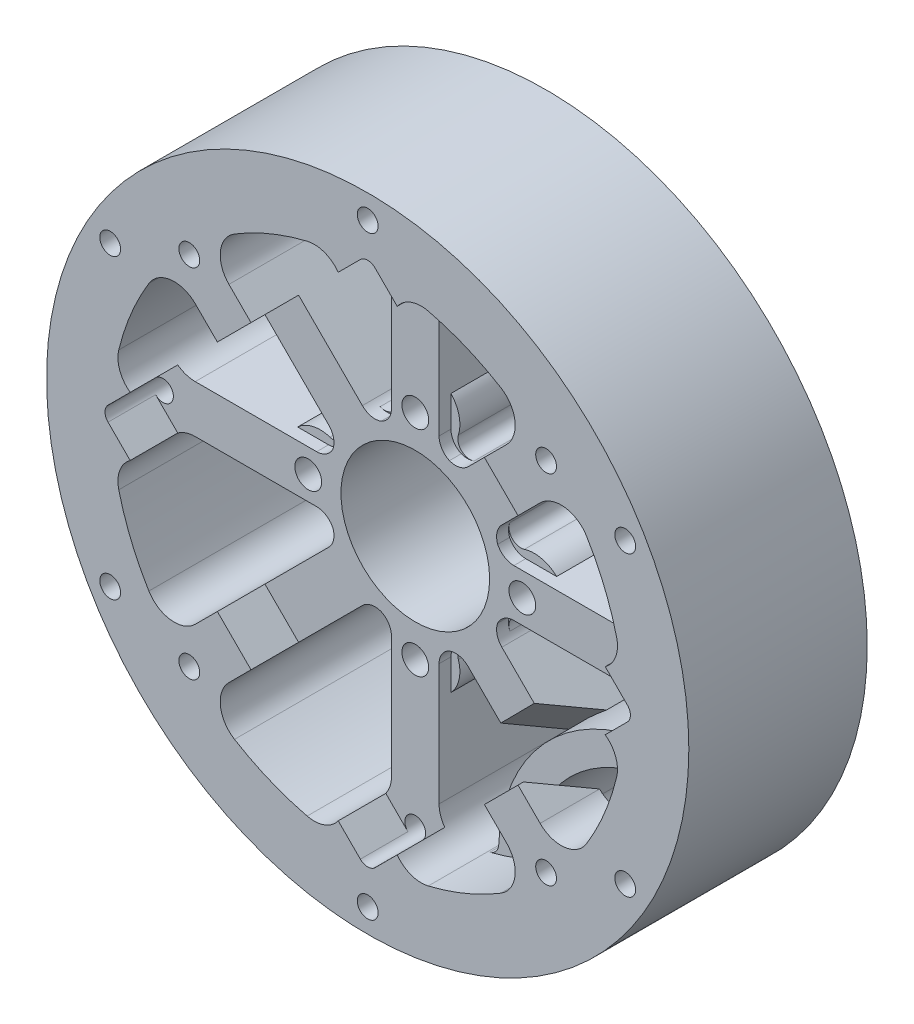
from build123d import *

# Parameters (mm, degrees)
SKETCH1_R                = 54
BOSS_EXTRUDE1_DEPTH      = 30
CUT_EXTRUDE4_DEPTH       = 68
SKETCH3_R                = 2.25
CUT_EXTRUDE5_DEPTH       = 64
SKETCH4_R                = 1.75
CUT_EXTRUDE6_DEPTH       = 50
FILLET1_R                = 5
FILLET3_R                = 3
SKETCH5_R                = 11
CUT_EXTRUDE7_DEPTH       = 20
SKETCH6_R                = 45.5
SKETCH6_R_2              = 43.5
BOSS_EXTRUDE2_DEPTH      = 20
CUT_EXTRUDE8_DEPTH       = 52
CIRPATTERN1_COUNT        = 8
CUT_EXTRUDE9_START       = -20
CUT_EXTRUDE9_DEPTH       = 20
CUT_EXTRUDE11_DEPTH      = 100.676435702
CUT_EXTRUDE11_DEPTH_BACK = 100.676435702
SKETCH13_W               = 15
SKETCH13_H               = 10
BOSS_EXTRUDE3_START      = -20
BOSS_EXTRUDE3_DEPTH      = 20
FILLET4_R                = 2
FILLET5_R                = 2
FILLET6_R                = 2
BOSS_EXTRUDE4_START      = -20
SKETCH16_R               = 5.5
SKETCH16_R_2             = 2.25
BOSS_EXTRUDE4_DEPTH      = 20
FILLET7_DEPTH            = 20
SKETCH17_R               = 12.5
CUT_EXTRUDE12_DEPTH      = 37
CUT_EXTRUDE14_DEPTH      = 8


with BuildPart() as part:
    # Sketch1 → Boss-Extrude1 (new body)
    with BuildSketch(Plane.XY):
        Circle(SKETCH1_R)
    extrude(amount=BOSS_EXTRUDE1_DEPTH)

    # Sketch2 → Cut-Extrude4 (cut)
    with BuildSketch(Plane.XY.offset(30)):
        with BuildLine():
            ThreePointArc((-7.394097025, 13.050951275), (-5.740251485, 13.858192988), (-4, 14.456832295))
            Line((-4, 14.456832295), (-4, 42.893897002))
            ThreePointArc((-4, 42.893897002), (-16.486002266, 39.800730261), (-27.502138317, 33.158992566))
            Line((-27.502138317, 33.158992566), (-7.394097025, 13.050951275))
        make_face()
        with BuildLine():
            Line((4, 42.893897002), (4, 14.456832295))
            ThreePointArc((4, 14.456832295), (5.740251485, 13.858192988), (7.394097025, 13.050951275))
            Line((7.394097025, 13.050951275), (27.502138317, 33.158992566))
            ThreePointArc((27.502138317, 33.158992566), (16.486002266, 39.800730261), (4, 42.893897002))
        make_face()
        with BuildLine():
            Line((33.158992566, 27.502138317), (13.050951275, 7.394097025))
            ThreePointArc((13.050951275, 7.394097025), (13.858192988, 5.740251485), (14.456832295, 4))
            Line((14.456832295, 4), (42.893897002, 4))
            ThreePointArc((42.893897002, 4), (39.800730261, 16.486002266), (33.158992566, 27.502138317))
        make_face()
        with BuildLine():
            Line((42.893897002, -4), (14.456832295, -4))
            ThreePointArc((14.456832295, -4), (13.858192988, -5.740251485), (13.050951275, -7.394097025))
            Line((13.050951275, -7.394097025), (33.158992566, -27.502138317))
            ThreePointArc((33.158992566, -27.502138317), (39.800730261, -16.486002266), (42.893897002, -4))
        make_face()
        with BuildLine():
            Line((27.502138317, -33.158992566), (7.394097025, -13.050951275))
            ThreePointArc((7.394097025, -13.050951275), (5.740251485, -13.858192988), (4, -14.456832295))
            Line((4, -14.456832295), (4, -42.893897002))
            ThreePointArc((4, -42.893897002), (16.486002266, -39.800730261), (27.502138317, -33.158992566))
        make_face()
        with BuildLine():
            ThreePointArc((-4, -14.456832295), (-5.740251485, -13.858192988), (-7.394097025, -13.050951275))
            Line((-7.394097025, -13.050951275), (-27.502138317, -33.158992566))
            ThreePointArc((-27.502138317, -33.158992566), (-16.486002266, -39.800730261), (-4, -42.893897002))
            Line((-4, -42.893897002), (-4, -14.456832295))
        make_face()
        with BuildLine():
            ThreePointArc((-13.050951275, -7.394097025), (-13.858192988, -5.740251485), (-14.456832295, -4))
            Line((-14.456832295, -4), (-42.893897002, -4))
            ThreePointArc((-42.893897002, -4), (-39.800730261, -16.486002266), (-33.158992566, -27.502138317))
            Line((-33.158992566, -27.502138317), (-13.050951275, -7.394097025))
        make_face()
        with BuildLine():
            ThreePointArc((-14.456832295, 4), (-13.858192988, 5.740251485), (-13.050951275, 7.394097025))
            Line((-13.050951275, 7.394097025), (-33.158992566, 27.502138317))
            ThreePointArc((-33.158992566, 27.502138317), (-39.800730261, 16.486002266), (-42.893897002, 4))
            Line((-42.893897002, 4), (-14.456832295, 4))
        make_face()
    extrude(amount=-CUT_EXTRUDE4_DEPTH, mode=Mode.SUBTRACT)

    # Sketch3 → Cut-Extrude5 (cut)
    with BuildSketch(Plane.XY.offset(30)):
        with Locations((0, 18)):
            Circle(SKETCH3_R)
        with Locations((18, 0)):
            Circle(SKETCH3_R)
        with Locations((0, -18)):
            Circle(SKETCH3_R)
        with Locations((-18, 0)):
            Circle(SKETCH3_R)
    extrude(amount=-CUT_EXTRUDE5_DEPTH, mode=Mode.SUBTRACT)

    # Sketch4 → Cut-Extrude6 (cut)
    with BuildSketch(Plane.XY.offset(30)):
        with Locations((0, 50)):
            Circle(SKETCH4_R)
        with Locations((43.301270189, 25)):
            Circle(SKETCH4_R)
        with Locations((43.301270189, -25)):
            Circle(SKETCH4_R)
        with Locations((0, -50)):
            Circle(SKETCH4_R)
        with Locations((-43.301270189, -25)):
            Circle(SKETCH4_R)
        with Locations((-43.301270189, 25)):
            Circle(SKETCH4_R)
    extrude(amount=-CUT_EXTRUDE6_DEPTH, mode=Mode.SUBTRACT)

    # Fillet1
    fillet1_edges = [part.edges().sort_by_distance(p)[0] for p in [
        (-33.158992566, 27.502138317, 15),
        (-42.893897002, 4, 15),
        (-27.502138317, -33.158992566, 15),
        (-4, -42.893897002, 15),
        (-42.893897002, -4, 15),
        (-33.158992566, -27.502138317, 15),
        (33.158992566, -27.502138317, 15),
        (42.893897002, -4, 15),
        (4, -42.893897002, 15),
        (27.502138317, -33.158992566, 15),
        (27.502138317, 33.158992566, 15),
        (4, 42.893897002, 15),
        (42.893897002, 4, 15),
        (33.158992566, 27.502138317, 15),
        (-4, 42.893897002, 15),
        (-27.502138317, 33.158992566, 15),
    ]]
    fillet(fillet1_edges, radius=FILLET1_R)

    # Fillet3
    # the kernel refuses this fillet: 3 mm, written as the material it adds along each edge
    with BuildSketch(Plane(origin=(-14.456832295, -4, 30), x_dir=(-1, 0, 0), z_dir=(0, 0, -1)), Plane(origin=(-7.394097025, -13.050951275, 30), x_dir=(-0.7071067811865792, -0.7071067811865157, 0), z_dir=(0, 0, -1)), Plane(origin=(4, -14.456832295, 30), x_dir=(0, -1, 0), z_dir=(0, 0, -1)), Plane(origin=(13.050951275, -7.394097025, 30), x_dir=(0.7071067811865726, -0.7071067811865225, 0), z_dir=(0, 0, -1)), Plane(origin=(14.456832295, 4, 30), x_dir=(1, 0, 0), z_dir=(0, 0, -1)), Plane(origin=(7.394097025, 13.050951275, 30), x_dir=(0.7071067811865331, 0.707106781186562, 0), z_dir=(0, 0, -1)), Plane(origin=(-4, 14.456832295, 30), x_dir=(0, 1, 0), z_dir=(0, 0, -1)), Plane(origin=(-13.050951275, 7.394097025, 30), x_dir=(-0.7071067811865053, 0.7071067811865897, 0), z_dir=(0, 0, -1))) as fillet3_piece_1:
        with BuildLine():
            CenterArc((2.126291657, -3), FILLET3_R, 90, 67.114619524)
            ThreePointArc((-0.637562335, -1.833333333), (-0.289095445, -0.926990211), (0, 0))
            Line((0, 0), (2.126291657, 0))
        make_face()
    extrude(amount=30)
    with BuildSketch(Plane(origin=(-13.050951275, -7.394097025, 30), x_dir=(-0.4356129740982292, 0.900134066013111, 0), z_dir=(0, 0, -1)), Plane(origin=(-4, -14.456832295, 30), x_dir=(-0.9445157900125684, 0.32846601409724885, 0), z_dir=(0, 0, -1)), Plane(origin=(14.456832295, -4, 30), x_dir=(-0.3284660140975722, -0.9445157900124558, 0), z_dir=(0, 0, -1)), Plane(origin=(13.050951275, 7.394097025, 30), x_dir=(0.4356129740977994, -0.9001340660133189, 0), z_dir=(0, 0, -1)), Plane(origin=(4, 14.456832295, 30), x_dir=(0.9445157900124527, -0.32846601409758125, 0), z_dir=(0, 0, -1)), Plane(origin=(-7.394097025, 13.050951275, 30), x_dir=(0.9001340660132181, 0.43561297409800753, 0), z_dir=(0, 0, -1)), Plane(origin=(-14.456832295, 4, 30), x_dir=(0.32846601409726156, 0.9445157900125638, 0), z_dir=(0, 0, -1))) as fillet3_piece_2:
        with BuildLine():
            CenterArc((2.135132825, -2.993714086), FILLET3_R, 93.709685261, 67.114619524)
            Line((-0.698414545, -2.008316044), (0, 0))
            ThreePointArc((0, 0), (0.97051492, -0.031429568), (1.941029841, 0))
        make_face()
    extrude(amount=30)
    with BuildSketch(Plane(origin=(7.394097025, -13.050951275, 30), x_dir=(0.7071067811865624, -0.7071067811865328, 0), z_dir=(0, 0, -1))) as fillet3_piece_3:
        with BuildLine():
            CenterArc((2.126291657, 3), FILLET3_R, 202.885380476, 67.114619524)
            ThreePointArc((-0.637562335, 1.833333333), (-0.289095445, 0.926990211), (0, 0))
            Line((0, 0), (2.126291657, 0))
        make_face()
    extrude(amount=30)

    # Sketch5 → Cut-Extrude7 (cut)
    with BuildSketch(Plane.XY.offset(30)):
        Circle(SKETCH5_R)
    extrude(amount=-CUT_EXTRUDE7_DEPTH, mode=Mode.SUBTRACT)

    # Sketch6 → Boss-Extrude2 (add)
    with BuildSketch(Plane.XY.offset(30)):
        Circle(SKETCH6_R)
        Circle(SKETCH6_R_2, mode=Mode.SUBTRACT)
    extrude(amount=-BOSS_EXTRUDE2_DEPTH)

    # Sketch7 → Cut-Extrude8 (cut)
    with BuildSketch(Plane.XY.offset(30)):
        with BuildLine():
            Line((-30, 28.25), (-30, 30))
            Line((-30, 30), (-28.25, 30))
            ThreePointArc((-28.25, 30), (-31.237436867, 31.237436867), (-30, 28.25))
        make_face()
        with BuildLine():
            Line((-28.25, 30), (-30, 30))
            Line((-30, 30), (-30, 28.25))
            ThreePointArc((-30, 28.25), (-28.762563133, 28.762563133), (-28.25, 30))
        make_face()
    cut_extrude8 = extrude(amount=-CUT_EXTRUDE8_DEPTH, mode=Mode.SUBTRACT)

    # CirPattern1: Cut-Extrude8 ×8 about axis
    cirpattern1_axis = Axis((0, 0, 0), (0, 0, 1))
    for i in range(1, CIRPATTERN1_COUNT):
        add(cut_extrude8.rotate(cirpattern1_axis, i * 360 / CIRPATTERN1_COUNT), mode=Mode.SUBTRACT)

    # Sketch9 → Cut-Extrude9 (cut)
    with BuildSketch(Plane(origin=(0, 0, 0), x_dir=(-1, 0, 0), z_dir=(0, 0, -1)).offset(CUT_EXTRUDE9_START)):
        with BuildLine():
            Line((-26.047884483, -20.391030233), (-36.798711455, -22.39958114))
            ThreePointArc((-36.798711455, -22.39958114), (-30.462160134, -30.462160134), (-22.39958114, -36.798711455))
            Line((-22.39958114, -36.798711455), (-20.391030233, -26.047884483))
            ThreePointArc((-20.391030233, -26.047884483), (-23.391092322, -23.391092322), (-26.047884483, -20.391030233))
        make_face()
    extrude(amount=CUT_EXTRUDE9_DEPTH, mode=Mode.SUBTRACT)

    # Sketch13 → Cut-Extrude11 (cut, two sides: drawn at the far end of the back side and taken through both)
    with BuildSketch(Plane(origin=(7.604244558, -7.524376901, -18.528959742), x_dir=(-0.7033639917323762, -0.7108298637045983, 0), z_dir=(0.3554149318522999, -0.3516819958661888, -0.866025403784438)).offset(-CUT_EXTRUDE11_DEPTH_BACK)):
        with Locations((0, -37.057919485)):
            Rectangle(SKETCH13_W, SKETCH13_H)
    extrude(amount=CUT_EXTRUDE11_DEPTH + CUT_EXTRUDE11_DEPTH_BACK, mode=Mode.SUBTRACT)

    # Sketch15 → Boss-Extrude3 (add)
    with BuildSketch(Plane(origin=(0, 0, 0), x_dir=(-1, 0, 0), z_dir=(0, 0, -1)).offset(BOSS_EXTRUDE3_START)):
        with BuildLine():
            ThreePointArc((-17.056184089, -39.559739437), (-24.04163056, -24.04163056), (-39.559739437, -17.056184089))
            ThreePointArc((-39.559739437, -17.056184089), (-40.543699656, -14.563475484), (-41.370766822, -12.014410203))
            ThreePointArc((-41.370766822, -12.014410203), (-20.506096654, -20.506096654), (-12.014410203, -41.370766822))
            ThreePointArc((-12.014410203, -41.370766822), (-14.563475484, -40.543699656), (-17.056184089, -39.559739437))
        make_face()
    extrude(amount=BOSS_EXTRUDE3_DEPTH)

    # Fillet4
    fillet4_edges = [part.edges().sort_by_distance(p)[0] for p in [
        (39.559739437, -17.056184089, 10),
        (17.056184089, -39.559739437, 10),
    ]]
    fillet(fillet4_edges, radius=FILLET4_R)

    # Fillet5
    fillet5_edges = [part.edges().sort_by_distance(p)[0] for p in [
        (41.370766822, -12.014410203, 10),
        (12.014410203, -41.370766822, 10),
    ]]
    fillet(fillet5_edges, radius=FILLET5_R)

    # Fillet6
    fillet6_edges = [part.edges().sort_by_distance(p)[0] for p in [
        (35.430140844, -24.5069688, 5.319284508),
        (24.879680968, -35.169416755, 5.319284508),
    ]]
    fillet(fillet6_edges, radius=FILLET6_R)

    # Sketch16 → Boss-Extrude4 (add)
    # profile 1 of 4: a face of its own
    with BuildSketch(Plane(origin=(0, 0, 0), x_dir=(-1, 0, 0), z_dir=(0, 0, -1)).offset(BOSS_EXTRUDE4_START)):
        with Locations((-18, 0)):
            Circle(SKETCH16_R)
        with Locations(Location((-18, 0, 0), (0, 0, 180))):
            Circle(SKETCH16_R_2, mode=Mode.SUBTRACT)
    # profile 2 of 4: a face of its own
    with BuildSketch(Plane(origin=(0, 0, 0), x_dir=(-1, 0, 0), z_dir=(0, 0, -1)).offset(BOSS_EXTRUDE4_START)):
        with Locations((0, 18)):
            Circle(SKETCH16_R)
        with Locations(Location((0, 18, 0), (0, 0, 180))):
            Circle(SKETCH16_R_2, mode=Mode.SUBTRACT)
    # profile 3 of 4: a face of its own
    with BuildSketch(Plane(origin=(0, 0, 0), x_dir=(-1, 0, 0), z_dir=(0, 0, -1)).offset(BOSS_EXTRUDE4_START)):
        with Locations((18, 0)):
            Circle(SKETCH16_R)
        with Locations(Location((18, 0, 0), (0, 0, 180))):
            Circle(SKETCH16_R_2, mode=Mode.SUBTRACT)
    # profile 4 of 4: a face of its own
    with BuildSketch(Plane(origin=(0, 0, 0), x_dir=(-1, 0, 0), z_dir=(0, 0, -1)).offset(BOSS_EXTRUDE4_START)):
        with Locations((0, -18)):
            Circle(SKETCH16_R)
        with Locations(Location((0, -18, 0), (0, 0, 180))):
            Circle(SKETCH16_R_2, mode=Mode.SUBTRACT)
    extrude(amount=BOSS_EXTRUDE4_DEPTH)

    # Fillet7: read off the stored shape, not the designer's step
    # Fillet7 outline → Fillet7 (add)
    with BuildSketch(Plane.XY):
        with BuildLine():
            ThreePointArc((-13.898716232, 7.911139358), (-14.278250956, 5.800443602), (-16.350070881, 5.246687898))
            ThreePointArc((-16.350070881, 5.246687898), (-15.588575744, 4.943180459), (-14.880649429, 4.529862251))
            ThreePointArc((-14.880649429, 4.529862251), (-14.288990687, 5.066880097), (-13.860074759, 5.741030941))
            ThreePointArc((-13.860074759, 5.741030941), (-13.676262349, 6.829702187), (-13.898716232, 7.911139358))
        make_face()
        with BuildLine():
            ThreePointArc((-14.880649429, -4.529862251), (-15.588575744, -4.943180459), (-16.350070881, -5.246687898))
            ThreePointArc((-16.350070881, -5.246687898), (-14.278250956, -5.800443602), (-13.898716232, -7.911139358))
            ThreePointArc((-13.898716232, -7.911139358), (-13.676262349, -6.829702187), (-13.860074759, -5.741030941))
            ThreePointArc((-13.860074759, -5.741030941), (-14.288990687, -5.066880097), (-14.880649429, -4.529862251))
        make_face()
        with BuildLine():
            ThreePointArc((-7.911139358, -13.898716232), (-5.800443602, -14.278250956), (-5.246687898, -16.350070881))
            ThreePointArc((-5.246687898, -16.350070881), (-4.943180459, -15.588575744), (-4.529862251, -14.880649429))
            ThreePointArc((-4.529862251, -14.880649429), (-5.066880097, -14.288990687), (-5.741030941, -13.860074759))
            ThreePointArc((-5.741030941, -13.860074759), (-6.829702187, -13.676262349), (-7.911139358, -13.898716232))
        make_face()
        with BuildLine():
            ThreePointArc((4.529862251, -14.880649429), (4.943180459, -15.588575744), (5.246687898, -16.350070881))
            ThreePointArc((5.246687898, -16.350070881), (5.800443602, -14.278250956), (7.911139358, -13.898716232))
            ThreePointArc((7.911139358, -13.898716232), (6.829702187, -13.676262349), (5.741030941, -13.860074759))
            ThreePointArc((5.741030941, -13.860074759), (5.066880097, -14.288990687), (4.529862251, -14.880649429))
        make_face()
        with BuildLine():
            ThreePointArc((13.898716232, -7.911139358), (14.278250956, -5.800443602), (16.350070881, -5.246687898))
            ThreePointArc((16.350070881, -5.246687898), (15.588575744, -4.943180459), (14.880649429, -4.529862251))
            ThreePointArc((14.880649429, -4.529862251), (14.288990687, -5.066880097), (13.860074759, -5.741030941))
            ThreePointArc((13.860074759, -5.741030941), (13.676262349, -6.829702187), (13.898716232, -7.911139358))
        make_face()
        with BuildLine():
            ThreePointArc((14.880649429, 4.529862251), (15.588575744, 4.943180459), (16.350070881, 5.246687898))
            ThreePointArc((16.350070881, 5.246687898), (14.278250956, 5.800443602), (13.898716232, 7.911139358))
            ThreePointArc((13.898716232, 7.911139358), (13.676262349, 6.829702187), (13.860074759, 5.741030941))
            ThreePointArc((13.860074759, 5.741030941), (14.288990687, 5.066880097), (14.880649429, 4.529862251))
        make_face()
        with BuildLine():
            ThreePointArc((7.911139358, 13.898716232), (5.800443602, 14.278250956), (5.246687898, 16.350070881))
            ThreePointArc((5.246687898, 16.350070881), (4.943180459, 15.588575744), (4.529862251, 14.880649429))
            ThreePointArc((4.529862251, 14.880649429), (5.066880097, 14.288990687), (5.741030941, 13.860074759))
            ThreePointArc((5.741030941, 13.860074759), (6.829702187, 13.676262349), (7.911139358, 13.898716232))
        make_face()
        with BuildLine():
            ThreePointArc((-4.529862251, 14.880649429), (-4.943180459, 15.588575744), (-5.246687898, 16.350070881))
            ThreePointArc((-5.246687898, 16.350070881), (-5.800443602, 14.278250956), (-7.911139358, 13.898716232))
            ThreePointArc((-7.911139358, 13.898716232), (-6.829702187, 13.676262349), (-5.741030941, 13.860074759))
            ThreePointArc((-5.741030941, 13.860074759), (-5.066880097, 14.288990687), (-4.529862251, 14.880649429))
        make_face()
    extrude(amount=FILLET7_DEPTH)

    # Sketch17 → Cut-Extrude12 (cut)
    with BuildSketch(Plane.XY.offset(30)):
        Circle(SKETCH17_R)
    extrude(amount=-CUT_EXTRUDE12_DEPTH, mode=Mode.SUBTRACT)

    # Sketch18 → Cut-Extrude14 (cut)
    with BuildSketch(Plane.XY.offset(30)):
        with BuildLine():
            Line((1.237436867, 43.663843738), (43.663843738, 1.237436867))
            ThreePointArc((43.663843738, 1.237436867), (44.176406871, 0), (43.663843738, -1.237436867))
            Line((43.663843738, -1.237436867), (1.237436867, -43.663843738))
            ThreePointArc((1.237436867, -43.663843738), (0, -44.176406871), (-1.237436867, -43.663843738))
            Line((-1.237436867, -43.663843738), (-43.663843738, -1.237436867))
            ThreePointArc((-43.663843738, -1.237436867), (-44.176406871, 0), (-43.663843738, 1.237436867))
            Line((-43.663843738, 1.237436867), (-1.237436867, 43.663843738))
            ThreePointArc((-1.237436867, 43.663843738), (0, 44.176406871), (1.237436867, 43.663843738))
        make_face()
    extrude(amount=-CUT_EXTRUDE14_DEPTH, mode=Mode.SUBTRACT)


solid = part.part
